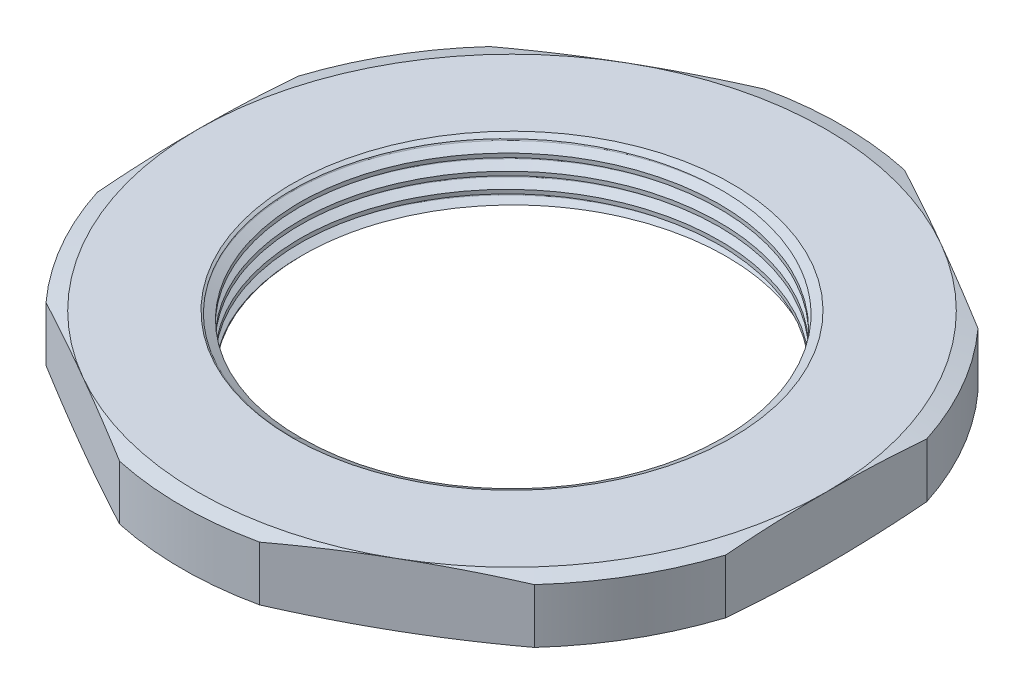
from build123d import *

# Parameters (mm, degrees)
SKETCH2_R           = 14
BOSS_EXTRUDE1_DEPTH = 4
CUT_SWEEP1_PITCH    = 1


with BuildPart() as part:
    # Sketch1 → Revolve1 (revolve)
    with BuildSketch(Plane(origin=(0, 0, 0), x_dir=(0, 0, -1), z_dir=(1, 0, 0))):
        Polygon((-14, 2), (-20, 2), (-20, -2), (-14, -2), (-13.350480947, -1.625), (-13.350480947, 1.625), align=None)
    revolve(axis=Axis((0, 0, 0), (0, -1, 0)))

    # Sketch2 → Boss-Extrude1 (add)
    with BuildSketch(Plane(origin=(0, 2, 0), x_dir=(1, 0, 0), z_dir=(0, 1, 0))):
        Polygon((-20, -11.547005384), (0, -23.094010768), (20, -11.547005384), (20, 11.547005384), (0, 23.094010768), (-20, 11.547005384), align=None)
        Circle(SKETCH2_R, mode=Mode.SUBTRACT)
    extrude(amount=-BOSS_EXTRUDE1_DEPTH)

    # Sketch3 → Cut-Revolve1 (revolve, cut)
    with BuildSketch(Plane(origin=(0, 0, 0), x_dir=(0, 0, -1), z_dir=(1, 0, 0))):
        Polygon((-23.094010768, 2), (-20, 2), (-21, 1.732050808), (-21, -1.732050808), (-20, -2), (-23.094010768, -2), align=None)
    revolve(axis=Axis((0, 0, 0), (0, -1, 0)), mode=Mode.SUBTRACT)

    # Cut-Sweep1: the profile of Sketch5 screwed along a right-hand helix of 6 turns, 8 arcs to a turn; built about Z, then put on its axis
    cut_sweep1_z = Axis((0, 0, 0), (0, 0, 1))
    cut_sweep1_corners = [(13.350480947, 0, 0.375), (13.891746825, 0, 0.0625), (13.927831216, 0, 0), (13.891746825, 0, -0.0625), (13.350480947, 0, -0.375), (13.133974596, 0, -0.375), (13.133974596, 0, 0.375)]
    with BuildLine(mode=Mode.PRIVATE) as cut_sweep1_profile:
        Line(cut_sweep1_corners[0], cut_sweep1_corners[1])
        Line(cut_sweep1_corners[3], cut_sweep1_corners[4])
        Line(cut_sweep1_corners[4], cut_sweep1_corners[5])
        Line(cut_sweep1_corners[5], cut_sweep1_corners[6])
        Line(cut_sweep1_corners[6], cut_sweep1_corners[0])
        ThreePointArc((13.891746825, 0, 0.0625), (13.918162433, 0, 0.036084392), (13.927831216, 0, 0))
        ThreePointArc((13.927831216, 0, 0), (13.918162433, 0, -0.036084392), (13.891746825, 0, -0.0625))
    cut_sweep1_cap = Face(cut_sweep1_profile.wire())
    cut_sweep1_arcs = [((13.891746825, 0, 0.0625), (13.927831216, 0, 0.041666667), (13.927831216, 0, 0), (1, 0.8660254037844459, 1)), ((13.927831216, 0, 0), (13.927831216, 0, -0.041666667), (13.891746825, 0, -0.0625), (1, 0.8660254037844459, 1))]  # start, shoulder, end, weights
    cut_sweep1_turn_angles = [0, 22.5, 45, 67.5, 90, 112.5, 135, 157.5, 180, 202.5, 225, 247.5, 270, 292.5, 315, 337.5, 360]
    cut_sweep1_turn_weights = [1, 0.9238795325112867, 1, 0.9238795325112867, 1, 0.9238795325112867, 1, 0.9238795325112867, 1, 0.9238795325112867, 1, 0.9238795325112867, 1, 0.9238795325112867, 1, 0.9238795325112867, 1]
    cut_sweep1_turn_rails = [Edge.make_bspline([Vector(p[0], p[1], 0).rotate(cut_sweep1_z, cut_sweep1_turn_angles[k]) / cut_sweep1_turn_weights[k] + Vector(0, 0, p[2] + CUT_SWEEP1_PITCH * cut_sweep1_turn_angles[k] / 360) for k in range(17)], [0, 0, 0, 1, 1, 2, 2, 3, 3, 4, 4, 5, 5, 6, 6, 7, 7, 8, 8, 8], 2, cut_sweep1_turn_weights) for p in cut_sweep1_corners]
    cut_sweep1_turn_sides = [*[Face.make_surface_from_curves(cut_sweep1_turn_rails[p[0]], cut_sweep1_turn_rails[p[1]]) for p in [(0, 1), (3, 4), (4, 5), (5, 6), (6, 0)]], *[Face.make_bezier_surface([[Vector(p[j][0], p[j][1], 0).rotate(cut_sweep1_z, cut_sweep1_turn_angles[2 * i + k]) / cut_sweep1_turn_weights[2 * i + k] + Vector(0, 0, p[j][2] + CUT_SWEEP1_PITCH * cut_sweep1_turn_angles[2 * i + k] / 360) for k in range(3)] for j in range(3)], [[p[3][j] * cut_sweep1_turn_weights[2 * i + k] for k in range(3)] for j in range(3)]) for p in cut_sweep1_arcs for i in range(8)]]
    cut_sweep1 = Plane(origin=(0, 2, 0), x_dir=(0, 0, 1), z_dir=(0, -1, 0)) * Solid(Shell([*[p.moved(Location((0, 0, CUT_SWEEP1_PITCH * i))) for i in range(6) for p in cut_sweep1_turn_sides], cut_sweep1_cap, cut_sweep1_cap.rotate(cut_sweep1_z, 2160).moved(Location((0, 0, CUT_SWEEP1_PITCH * 2160 / 360)))]))
    add(cut_sweep1, mode=Mode.SUBTRACT)


solid = part.part
